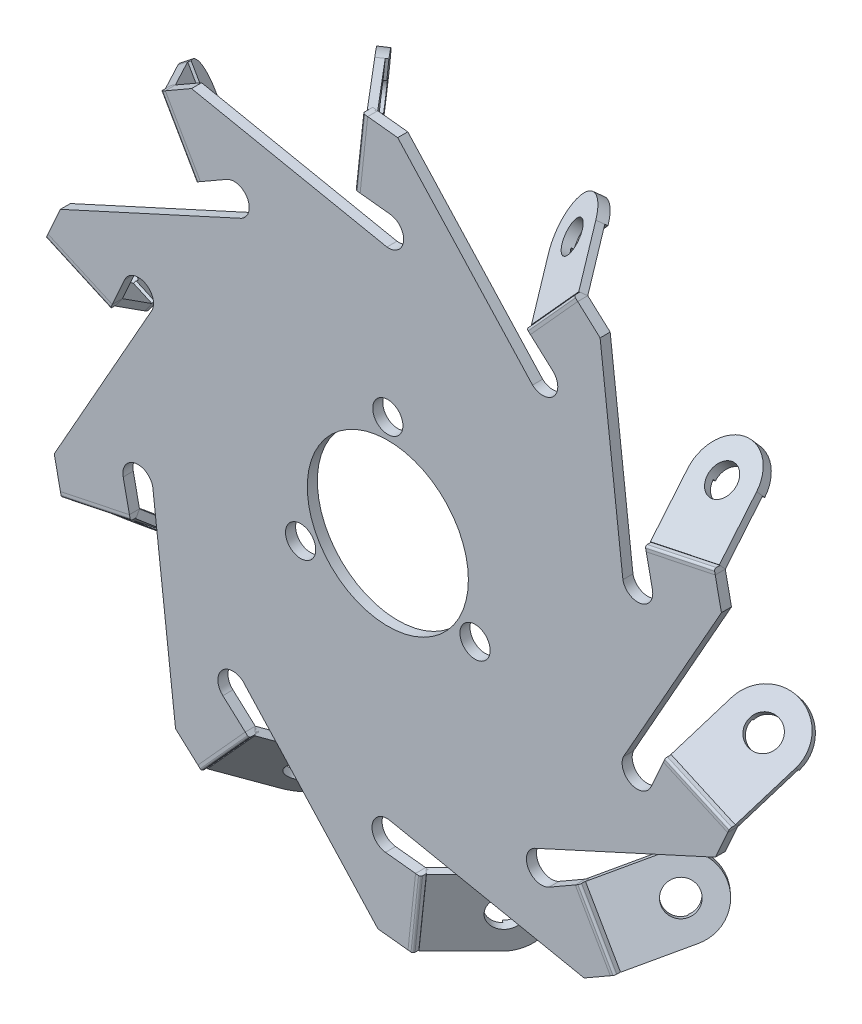
from build123d import *

# Parameters (mm, degrees)
SKETCH1_R           = 8
BOSS_EXTRUDE2_DEPTH = 1
BASE_FLANGE1_START  = -7
BASE_FLANGE1_DEPTH  = 7
BOSS_EXTRUDE3_DEPTH = 1
SKETCH30_R          = 1.5
CUT_EXTRUDE1_DEPTH  = 1
SKETCH33_W          = 1
SKETCH33_H          = 7
BOSS_EXTRUDE4_DEPTH = 0.5
FILLET1_R           = 0.2
CIRPATTERN2_COUNT   = 10
SKETCH34_R          = 1.5
CUT_EXTRUDE2_DEPTH  = 1
CIRPATTERN3_COUNT   = 3


# Sheet-metal steps are written as plain solids
with BuildPart() as part:
    # Sketch1 → Boss-Extrude2 (new body)
    with BuildSketch(Plane.XY):
        with BuildLine():
            Line((0.231479855, 27.556947399), (-2.751295455, 27.877963681))
            Line((-2.751295455, 27.877963681), (-2.002257464, 34.837772737))
            Line((-2.002257464, 34.837772737), (0.980517846, 34.516756455))
            Line((0.980517846, 34.516756455), (14.37189945, 19.933551035))
            ThreePointArc((14.37189945, 19.933551035), (16.490582573, 20.039295192), (16.384838416, 22.157978314))
            Line((16.384838416, 22.157978314), (14.160411136, 24.17091728))
            Line((14.160411136, 24.17091728), (18.857268722, 29.361247599))
            Line((18.857268722, 29.361247599), (21.081696002, 27.348308633))
            Line((21.081696002, 27.348308633), (23.343758221, 7.678991001))
            ThreePointArc((23.343758221, 7.678991001), (25.119963729, 6.519209128), (26.279745602, 8.295414635))
            Line((26.279745602, 8.295414635), (25.663321968, 11.231402017))
            Line((25.663321968, 11.231402017), (32.513959191, 12.66972383))
            Line((32.513959191, 12.66972383), (33.130382825, 9.733736449))
            Line((33.130382825, 9.733736449), (23.399094776, -7.508682596))
            ThreePointArc((23.399094776, -7.508682596), (24.154372536, -9.490993244), (26.136683184, -8.735715484))
            Line((26.136683184, -8.735715484), (27.363716072, -5.998127075))
            Line((27.363716072, -5.998127075), (33.751422358, -8.861203814))
            Line((33.751422358, -8.861203814), (32.52438947, -11.598792222))
            Line((32.52438947, -11.598792222), (14.516772433, -19.828294652))
            ThreePointArc((14.516772433, -19.828294652), (13.962632012, -21.875958783), (16.010296143, -22.430099204))
            Line((16.010296143, -22.430099204), (18.612100695, -20.936575494))
            Line((18.612100695, -20.936575494), (22.096989353, -27.007452782))
            Line((22.096989353, -27.007452782), (19.495184801, -28.500976492))
            Line((19.495184801, -28.500976492), (0.089536427, -24.57417209))
            ThreePointArc((0.089536427, -24.57417209), (-1.562359368, -25.905051604), (-0.231479855, -27.556947399))
            Line((-0.231479855, -27.556947399), (2.751295455, -27.877963681))
            Line((2.751295455, -27.877963681), (2.002257464, -34.837772737))
            Line((2.002257464, -34.837772737), (-0.980517846, -34.516756455))
            Line((-0.980517846, -34.516756455), (-14.37189945, -19.933551035))
            ThreePointArc((-14.37189945, -19.933551035), (-16.490582573, -20.039295192), (-16.384838416, -22.157978314))
            Line((-16.384838416, -22.157978314), (-14.160411136, -24.17091728))
            Line((-14.160411136, -24.17091728), (-18.857268722, -29.361247599))
            Line((-18.857268722, -29.361247599), (-21.081696002, -27.348308633))
            Line((-21.081696002, -27.348308633), (-23.343758221, -7.678991001))
            ThreePointArc((-23.343758221, -7.678991001), (-25.119963729, -6.519209128), (-26.279745602, -8.295414635))
            Line((-26.279745602, -8.295414635), (-25.663321968, -11.231402017))
            Line((-25.663321968, -11.231402017), (-32.513959191, -12.66972383))
            Line((-32.513959191, -12.66972383), (-33.130382825, -9.733736449))
            Line((-33.130382825, -9.733736449), (-23.399094776, 7.508682596))
            ThreePointArc((-23.399094776, 7.508682596), (-24.154372536, 9.490993244), (-26.136683184, 8.735715484))
            Line((-26.136683184, 8.735715484), (-27.363716072, 5.998127075))
            Line((-27.363716072, 5.998127075), (-33.751422358, 8.861203814))
            Line((-33.751422358, 8.861203814), (-32.52438947, 11.598792222))
            Line((-32.52438947, 11.598792222), (-14.516772433, 19.828294652))
            ThreePointArc((-14.516772433, 19.828294652), (-13.962632012, 21.875958783), (-16.010296143, 22.430099204))
            Line((-16.010296143, 22.430099204), (-18.612100695, 20.936575494))
            Line((-18.612100695, 20.936575494), (-22.096989353, 27.007452782))
            Line((-22.096989353, 27.007452782), (-19.495184801, 28.500976492))
            Line((-19.495184801, 28.500976492), (-0.089536427, 24.57417209))
            ThreePointArc((-0.089536427, 24.57417209), (1.562359368, 25.905051604), (0.231479855, 27.556947399))
        make_face()
        Circle(SKETCH1_R, mode=Mode.SUBTRACT)
    extrude(amount=BOSS_EXTRUDE2_DEPTH)

    # Sketch34 → Cut-Extrude2 (cut)
    with BuildSketch(Plane.XY.offset(1)):
        with Locations((0, 10)):
            Circle(SKETCH34_R)
    cut_extrude2 = extrude(amount=-CUT_EXTRUDE2_DEPTH, mode=Mode.SUBTRACT)

    # CirPattern3: Cut-Extrude2 ×3 about axis
    cirpattern3_axis = Axis((0, 0, 0), (0, 0, 1))
    for i in range(1, CIRPATTERN3_COUNT):
        add(cut_extrude2.rotate(cirpattern3_axis, i * 360 / CIRPATTERN3_COUNT), mode=Mode.SUBTRACT)


with BuildPart() as body_2:
    # Sketch5 → Base-Flange1 (new body)
    with BuildSketch(Plane(origin=(3.68350101, 34.225852342, 0), x_dir=(0.9942584364862397, -0.1070054273200107, 0), z_dir=(0.1070054273200107, 0.9942584364862397, 0)).offset(BASE_FLANGE1_START)):
        Polygon((-5.718592134, 0), (-9.471119507, 4.472087978), (-10.035387844, 3.998610625), (-6.282860471, -0.473477353), align=None)
    extrude(amount=BASE_FLANGE1_DEPTH)

    # Sketch29 → Boss-Extrude3 (add)
    with BuildSketch(Plane(origin=(-3.89756859, 0.419469403, 3.289334288), x_dir=(0.6390970037996644, -0.06878176285051624, 0.7660444431189793), z_dir=(-0.7616461502944486, 0.08197091298206609, 0.6427876096865379))):
        with BuildLine():
            Line((-9.513736413, 29.423497036), (-9.513736413, 27.423497036))
            ThreePointArc((-9.513736413, 27.423497036), (-13.013736413, 30.923497036), (-9.513736413, 34.423497036))
            Line((-9.513736413, 34.423497036), (-9.513736413, 32.423497036))
            ThreePointArc((-9.513736413, 32.423497036), (-11.013736413, 30.923497036), (-9.513736413, 29.423497036))
        make_face()
    extrude(amount=-BOSS_EXTRUDE3_DEPTH)

    # Sketch30 → Cut-Extrude1 (cut)
    with BuildSketch(Plane(origin=(-3.89756859, 0.419469403, 3.289334288), x_dir=(0.6390970037996644, -0.06878176285051624, 0.7660444431189793), z_dir=(-0.7616461502944486, 0.08197091298206609, 0.6427876096865379))):
        with Locations(Location((-9.513736413, 30.923497036, 0), (0, 0, 90))):
            Circle(SKETCH30_R)
    extrude(amount=-CUT_EXTRUDE1_DEPTH, mode=Mode.SUBTRACT)


with BuildPart() as body_3:
    # Sketch33 → Boss-Extrude4 (new body)
    with BuildSketch(Plane(origin=(-5.685758474, 0.611920395, 0), x_dir=(0, 0, 1), z_dir=(-0.9942584364862397, 0.10700542732001145, 0))):
        with Locations((0.5, 30.923497036)):
            Rectangle(SKETCH33_W, SKETCH33_H)
    extrude(amount=BOSS_EXTRUDE4_DEPTH)

    # Fillet1
    fillet1_edges = [body_3.edges().sort_by_distance(p)[0] for p in [
        (-2.873905678, 31.411370923, 1),
    ]]
    fillet(fillet1_edges, radius=FILLET1_R)


with BuildPart() as cirpattern2_1:
    # CirPattern2: pattern copy
    add(body_3.part.rotate(Axis((0, 0, 0), (0, 0, 1)), 1 * 360 / CIRPATTERN2_COUNT))


with BuildPart() as cirpattern2_2:
    # CirPattern2: pattern copy
    add(body_3.part.rotate(Axis((0, 0, 0), (0, 0, 1)), 2 * 360 / CIRPATTERN2_COUNT))


with BuildPart() as cirpattern2_3:
    # CirPattern2: pattern copy
    add(body_3.part.rotate(Axis((0, 0, 0), (0, 0, 1)), 3 * 360 / CIRPATTERN2_COUNT))


with BuildPart() as cirpattern2_4:
    # CirPattern2: pattern copy
    add(body_3.part.rotate(Axis((0, 0, 0), (0, 0, 1)), 4 * 360 / CIRPATTERN2_COUNT))


with BuildPart() as cirpattern2_5:
    # CirPattern2: pattern copy
    add(body_3.part.rotate(Axis((0, 0, 0), (0, 0, 1)), 5 * 360 / CIRPATTERN2_COUNT))


with BuildPart() as cirpattern2_6:
    # CirPattern2: pattern copy
    add(body_3.part.rotate(Axis((0, 0, 0), (0, 0, 1)), 6 * 360 / CIRPATTERN2_COUNT))


with BuildPart() as cirpattern2_7:
    # CirPattern2: pattern copy
    add(body_3.part.rotate(Axis((0, 0, 0), (0, 0, 1)), 7 * 360 / CIRPATTERN2_COUNT))


with BuildPart() as cirpattern2_8:
    # CirPattern2: pattern copy
    add(body_3.part.rotate(Axis((0, 0, 0), (0, 0, 1)), 8 * 360 / CIRPATTERN2_COUNT))


with BuildPart() as cirpattern2_9:
    # CirPattern2: pattern copy
    add(body_3.part.rotate(Axis((0, 0, 0), (0, 0, 1)), 9 * 360 / CIRPATTERN2_COUNT))


with BuildPart() as cirpattern2_10:
    # CirPattern2: pattern copy
    add(body_2.part.rotate(Axis((0, 0, 0), (0, 0, 1)), 1 * 360 / CIRPATTERN2_COUNT))


with BuildPart() as cirpattern2_11:
    # CirPattern2: pattern copy
    add(body_2.part.rotate(Axis((0, 0, 0), (0, 0, 1)), 2 * 360 / CIRPATTERN2_COUNT))


with BuildPart() as cirpattern2_12:
    # CirPattern2: pattern copy
    add(body_2.part.rotate(Axis((0, 0, 0), (0, 0, 1)), 3 * 360 / CIRPATTERN2_COUNT))


with BuildPart() as cirpattern2_13:
    # CirPattern2: pattern copy
    add(body_2.part.rotate(Axis((0, 0, 0), (0, 0, 1)), 4 * 360 / CIRPATTERN2_COUNT))


with BuildPart() as cirpattern2_14:
    # CirPattern2: pattern copy
    add(body_2.part.rotate(Axis((0, 0, 0), (0, 0, 1)), 5 * 360 / CIRPATTERN2_COUNT))


with BuildPart() as cirpattern2_15:
    # CirPattern2: pattern copy
    add(body_2.part.rotate(Axis((0, 0, 0), (0, 0, 1)), 6 * 360 / CIRPATTERN2_COUNT))


with BuildPart() as cirpattern2_16:
    # CirPattern2: pattern copy
    add(body_2.part.rotate(Axis((0, 0, 0), (0, 0, 1)), 7 * 360 / CIRPATTERN2_COUNT))


with BuildPart() as cirpattern2_17:
    # CirPattern2: pattern copy
    add(body_2.part.rotate(Axis((0, 0, 0), (0, 0, 1)), 8 * 360 / CIRPATTERN2_COUNT))


with BuildPart() as cirpattern2_18:
    # CirPattern2: pattern copy
    add(body_2.part.rotate(Axis((0, 0, 0), (0, 0, 1)), 9 * 360 / CIRPATTERN2_COUNT))


solid = Compound([part.part, body_2.part, body_3.part, cirpattern2_1.part, cirpattern2_2.part, cirpattern2_3.part, cirpattern2_4.part, cirpattern2_5.part, cirpattern2_6.part, cirpattern2_7.part, cirpattern2_8.part, cirpattern2_9.part, cirpattern2_10.part, cirpattern2_11.part, cirpattern2_12.part, cirpattern2_13.part, cirpattern2_14.part, cirpattern2_15.part, cirpattern2_16.part, cirpattern2_17.part, cirpattern2_18.part])
